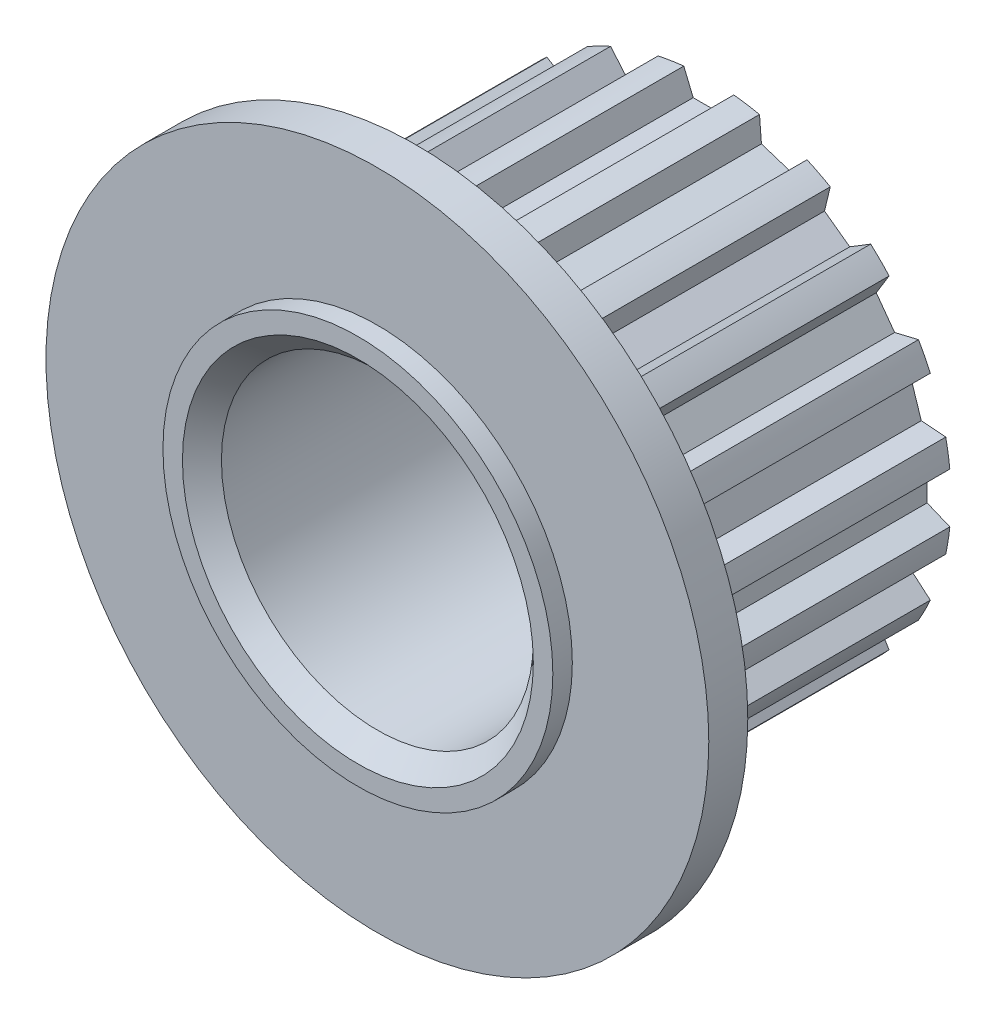
from build123d import *

# Parameters (mm, degrees)
CUT_EXTRUDE1_DEPTH       = 3
CHAMFER1_SIZE            = 0.259911356
CHAMFER1_SIZE2           = 0.226339217
CUT_EXTRUDE2_START       = 1
CUT_EXTRUDE2_2_OUTLINE_W = 16
CUT_EXTRUDE2_2_OUTLINE_H = 4
CUT_EXTRUDE2_2_DEPTH     = 6.45
CUT_EXTRUDE2_START_2     = 7.45
CUT_EXTRUDE2_3_OUTLINE_R = 5
CUT_EXTRUDE2_3_DEPTH     = 7.5


with BuildPart() as part:
    # Sketch1 → Revolve1 (revolve)
    with BuildSketch(Plane.XY.offset(3.725), mode=Mode.PRIVATE) as revolve1_sk:
        Polygon((1.614337285, 9), (0, 9), (0, 5), (0.595828025, 5), (1.614337285, 5.592863599), align=None)
    revolve(revolve1_sk.sketch.rotate(Axis((0, 9, 3.725), (0, -1, 0)), 270), axis=Axis((0, 9, 3.725), (0, -1, 0)))

    # Sketch2 → Cut-Extrude1 (cut)
    with BuildSketch(Plane(origin=(0, 9, 0), x_dir=(-1, 0, 0), z_dir=(0, 1, 0))):
        Polygon((0.877701457, 2.974684409), (1.088643091, 4.109953963), (0.210941634, 4.860269554), (-0.877701457, 4.475315591), (-1.088643091, 3.340046037), (-0.210941634, 2.589730446), align=None)
    extrude(amount=-CUT_EXTRUDE1_DEPTH, mode=Mode.SUBTRACT)

    # Chamfer1
    chamfer1_edges = [part.edges().sort_by_distance(p)[0] for p in [
        (0, 9, 5.339337285),
    ]]
    chamfer1_side = [part.faces().sort_by_distance(p)[0] for p in [
        (0, 9, 5.293676931),
    ]]
    chamfer(chamfer1_edges, length=CHAMFER1_SIZE, length2=CHAMFER1_SIZE2, reference=chamfer1_side[0])

    # Cut-Extrude2 2 outline → Cut-Extrude2 2 (cut)
    with BuildSketch(Plane.XY.offset(CUT_EXTRUDE2_START)):
        with Locations((0, 7)):
            Rectangle(CUT_EXTRUDE2_2_OUTLINE_W, CUT_EXTRUDE2_2_OUTLINE_H)
    extrude(amount=CUT_EXTRUDE2_2_DEPTH, mode=Mode.SUBTRACT)


with BuildPart() as body_2:
    # Cut-Extrude2: read off the stored shape, not the designer's step
    # Cut-Extrude2 outline → Cut-Extrude2 (revolve)
    with BuildSketch(Plane.XZ):
        Polygon((4, 7.45), (5, 7.45), (5, 14.95), (8.5, 14.95), (8.5, 15.95), (5, 15.95), (5, 16.45), (4.5, 16.45), (4, 15.95), align=None)
    revolve(axis=Axis((0, 0, 0), (0, 0, 1)))

    # Cut-Extrude2 3 outline → Cut-Extrude2 3 (add)
    with BuildSketch(Plane.XY.offset(CUT_EXTRUDE2_START_2)):
        with BuildLine():
            Line((1.30065941, -6.077376909), (1.350072562, -5.449523289))
            Line((1.350072562, -5.449523289), (2.110917775, -5.202309694))
            Line((2.110917775, -5.202309694), (2.519936953, -5.681209621))
            ThreePointArc((2.519936953, -5.681209621), (2.821550956, -5.537605548), (3.115013354, -5.37800305))
            Line((3.115013354, -5.37800305), (2.967990615, -4.765609269))
            Line((2.967990615, -4.765609269), (3.615204211, -4.295381068))
            Line((3.615204211, -4.295381068), (4.152192781, -4.624448087))
            ThreePointArc((4.152192781, -4.624448087), (4.394668645, -4.394668645), (4.624448087, -4.152192781))
            Line((4.624448087, -4.152192781), (4.295381068, -3.615204211))
            Line((4.295381068, -3.615204211), (4.765609269, -2.967990615))
            Line((4.765609269, -2.967990615), (5.37800305, -3.115013354))
            ThreePointArc((5.37800305, -3.115013354), (5.537605548, -2.821550956), (5.681209621, -2.519936953))
            Line((5.681209621, -2.519936953), (5.202309694, -2.110917775))
            Line((5.202309694, -2.110917775), (5.449523289, -1.350072562))
            Line((5.449523289, -1.350072562), (6.077376909, -1.30065941))
            ThreePointArc((6.077376909, -1.30065941), (6.138483037, -0.9722402), (6.181854773, -0.641012138))
            Line((6.181854773, -0.641012138), (5.6, -0.4))
            Line((5.6, -0.4), (5.6, 0.4))
            Line((5.6, 0.4), (6.181854773, 0.641012138))
            ThreePointArc((6.181854773, 0.641012138), (6.138483037, 0.9722402), (6.077376909, 1.30065941))
            Line((6.077376909, 1.30065941), (5.449523289, 1.350072562))
            Line((5.449523289, 1.350072562), (5.202309694, 2.110917775))
            Line((5.202309694, 2.110917775), (5.681209621, 2.519936953))
            ThreePointArc((5.681209621, 2.519936953), (5.537605548, 2.821550956), (5.37800305, 3.115013354))
            Line((5.37800305, 3.115013354), (4.765609269, 2.967990615))
            Line((4.765609269, 2.967990615), (4.295381068, 3.615204211))
            Line((4.295381068, 3.615204211), (4.624448087, 4.152192781))
            ThreePointArc((4.624448087, 4.152192781), (4.394668645, 4.394668645), (4.152192781, 4.624448087))
            Line((4.152192781, 4.624448087), (3.615204211, 4.295381068))
            Line((3.615204211, 4.295381068), (2.967990615, 4.765609269))
            Line((2.967990615, 4.765609269), (3.115013354, 5.37800305))
            ThreePointArc((3.115013354, 5.37800305), (2.821550956, 5.537605548), (2.519936953, 5.681209621))
            Line((2.519936953, 5.681209621), (2.110917775, 5.202309694))
            Line((2.110917775, 5.202309694), (1.350072562, 5.449523289))
            Line((1.350072562, 5.449523289), (1.30065941, 6.077376909))
            ThreePointArc((1.30065941, 6.077376909), (0.9722402, 6.138483037), (0.641012138, 6.181854773))
            Line((0.641012138, 6.181854773), (0.4, 5.6))
            Line((0.4, 5.6), (-0.4, 5.6))
            Line((-0.4, 5.6), (-0.641012138, 6.181854773))
            ThreePointArc((-0.641012138, 6.181854773), (-0.9722402, 6.138483037), (-1.30065941, 6.077376909))
            Line((-1.30065941, 6.077376909), (-1.350072562, 5.449523289))
            Line((-1.350072562, 5.449523289), (-2.110917775, 5.202309694))
            Line((-2.110917775, 5.202309694), (-2.519936953, 5.681209621))
            ThreePointArc((-2.519936953, 5.681209621), (-2.821550956, 5.537605548), (-3.115013354, 5.37800305))
            Line((-3.115013354, 5.37800305), (-2.967990615, 4.765609269))
            Line((-2.967990615, 4.765609269), (-3.615204211, 4.295381068))
            Line((-3.615204211, 4.295381068), (-4.152192781, 4.624448087))
            ThreePointArc((-4.152192781, 4.624448087), (-4.394668645, 4.394668645), (-4.624448087, 4.152192781))
            Line((-4.624448087, 4.152192781), (-4.295381068, 3.615204211))
            Line((-4.295381068, 3.615204211), (-4.765609269, 2.967990615))
            Line((-4.765609269, 2.967990615), (-5.37800305, 3.115013354))
            ThreePointArc((-5.37800305, 3.115013354), (-5.537605548, 2.821550956), (-5.681209621, 2.519936953))
            Line((-5.681209621, 2.519936953), (-5.202309694, 2.110917775))
            Line((-5.202309694, 2.110917775), (-5.449523289, 1.350072562))
            Line((-5.449523289, 1.350072562), (-6.077376909, 1.30065941))
            ThreePointArc((-6.077376909, 1.30065941), (-6.138483037, 0.9722402), (-6.181854773, 0.641012138))
            Line((-6.181854773, 0.641012138), (-5.6, 0.4))
            Line((-5.6, 0.4), (-5.6, -0.4))
            Line((-5.6, -0.4), (-6.181854773, -0.641012138))
            ThreePointArc((-6.181854773, -0.641012138), (-6.138483037, -0.9722402), (-6.077376909, -1.30065941))
            Line((-6.077376909, -1.30065941), (-5.449523289, -1.350072562))
            Line((-5.449523289, -1.350072562), (-5.202309694, -2.110917775))
            Line((-5.202309694, -2.110917775), (-5.681209621, -2.519936953))
            ThreePointArc((-5.681209621, -2.519936953), (-5.537605548, -2.821550956), (-5.37800305, -3.115013354))
            Line((-5.37800305, -3.115013354), (-4.765609269, -2.967990615))
            Line((-4.765609269, -2.967990615), (-4.295381068, -3.615204211))
            Line((-4.295381068, -3.615204211), (-4.624448087, -4.152192781))
            ThreePointArc((-4.624448087, -4.152192781), (-4.394668645, -4.394668645), (-4.152192781, -4.624448087))
            Line((-4.152192781, -4.624448087), (-3.615204211, -4.295381068))
            Line((-3.615204211, -4.295381068), (-2.967990615, -4.765609269))
            Line((-2.967990615, -4.765609269), (-3.115013354, -5.37800305))
            ThreePointArc((-3.115013354, -5.37800305), (-2.821550956, -5.537605548), (-2.519936953, -5.681209621))
            Line((-2.519936953, -5.681209621), (-2.110917775, -5.202309694))
            Line((-2.110917775, -5.202309694), (-1.350072562, -5.449523289))
            Line((-1.350072562, -5.449523289), (-1.30065941, -6.077376909))
            ThreePointArc((-1.30065941, -6.077376909), (-0.9722402, -6.138483037), (-0.641012138, -6.181854773))
            Line((-0.641012138, -6.181854773), (-0.4, -5.6))
            Line((-0.4, -5.6), (0.4, -5.6))
            Line((0.4, -5.6), (0.641012138, -6.181854773))
            ThreePointArc((0.641012138, -6.181854773), (0.9722402, -6.138483037), (1.30065941, -6.077376909))
        make_face()
        Circle(CUT_EXTRUDE2_3_OUTLINE_R, mode=Mode.SUBTRACT)
    extrude(amount=CUT_EXTRUDE2_3_DEPTH)


solid = body_2.part
